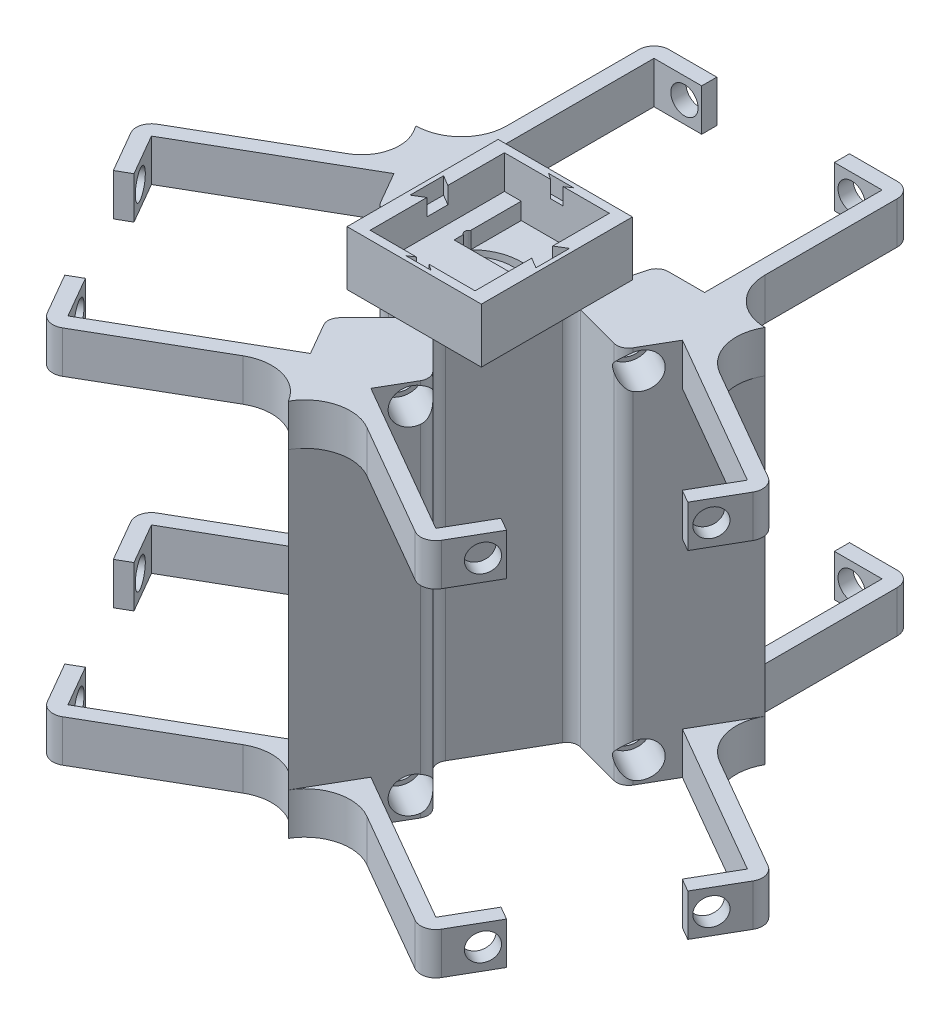
from build123d import *
from OCP.BRepAlgoAPI import BRepAlgoAPI_Cut
from OCP.TopTools import TopTools_ListOfShape

# Parameters (mm, degrees)
SALIENTE_EXTRUIR1_DEPTH = 95.5
CROQUIS4_R              = 3.25
CORTAR_EXTRUIR1_DEPTH   = 117.774868872
REDONDEO6_R             = 3
REDONDEO7_R             = 3
ESCALA2_SCALE           = 1.05
SALIENTE_EXTRUIR2_DEPTH = 100.275
REDONDEO8_R             = 12
REDONDEO9_R             = 12
REDONDEO12_R            = 12
REDONDEO13_R            = 12
REDONDEO14_R            = 12
REDONDEO16_R            = 10
REDONDEO17_R            = 3
ESCALA3_SCALE           = 0.9
CROQUIS25_W             = 45.9
CROQUIS25_H             = 70.2475
CORTAR_EXTRUIR8_DEPTH   = 157.896391831
MATRIZC1_START          = 12.62625
MATRIZC1_DEPTH          = 70.2475
CROQUIS27_R             = 4.25
CORTAR_EXTRUIR11_DEPTH  = 9
CROQUIS28_R             = 3.25
CORTAR_EXTRUIR12_DEPTH  = 1
MATRIZC2_START          = 15.015338577
MATRIZC2_OUTLINE_R      = 4.25
MATRIZC2_DEPTH          = 9
MATRIZC2_START_2        = 14.015338577
MATRIZC2_2_OUTLINE_R    = 3.25
MATRIZC2_2_DEPTH        = 1
MATRIZC2_START_3        = -23.99496433
MATRIZC2_3_OUTLINE_R    = 4.25
MATRIZC2_3_DEPTH        = 9
MATRIZC2_START_4        = -14.99496433
MATRIZC2_4_OUTLINE_R    = 3.25
MATRIZC2_4_DEPTH        = 1
CROQUIS29_R             = 3.25
CORTAR_EXTRUIR13_DEPTH  = 10
CROQUIS31_W             = 32
CROQUIS31_H             = 36
SALIENTE_EXTRUIR3_DEPTH = 13
CROQUIS33_W             = 25
CROQUIS33_H             = 32
CORTAR_EXTRUIR14_DEPTH  = 8
CORTAR_EXTRUIR15_DEPTH  = 146.30593318
CROQUIS39_W             = 17
CROQUIS39_H             = 16
CORTAR_EXTRUIR16_DEPTH  = 4
CORTAR_EXTRUIR17_DEPTH  = 4


with BuildPart() as part:
    # Croquis1 → Saliente-Extruir1 (new body)
    with BuildSketch(Plane(origin=(0, 0, 0), x_dir=(1, 0, 0), z_dir=(0, 1, 0))):
        Polygon((1.696358741, -16.064461222), (13.335, -27.703102481), (0, -50.8), (-13.335, -27.703102481), (-1.696358741, -16.064461222), (-14.760410887, 6.563140847), (-30.659090512, 2.303102481), (-43.994090512, 25.4), (-17.324090512, 25.4), (-13.064052146, 9.501320374), (13.064052146, 9.501320374), (17.324090512, 25.4), (43.994090512, 25.4), (30.659090512, 2.303102481), (14.760410887, 6.563140847), align=None)
    extrude(amount=SALIENTE_EXTRUIR1_DEPTH)

    # Croquis4 → Cortar-Extruir1 (cut, through all)
    with BuildSketch(Plane(origin=(0, 95.5, 0), x_dir=(1, 0, 0), z_dir=(0, 1, 0))):
        with Locations(Location((0, 0, 0), (0, 0, 270))):
            Circle(CROQUIS4_R)
    extrude(amount=-CORTAR_EXTRUIR1_DEPTH, mode=Mode.SUBTRACT)

    # Redondeo6
    redondeo6_edges = [part.edges().sort_by_distance(p)[0] for p in [
        (-1.696358741, 47.75, 16.064461222),
        (-14.760410887, 47.75, -6.563140847),
        (-13.064052146, 47.75, -9.501320374),
        (13.064052146, 47.75, -9.501320374),
        (1.696358741, 47.75, 16.064461222),
    ]]
    fillet(redondeo6_edges, radius=REDONDEO6_R)

    # Redondeo7
    redondeo7_edges = [part.edges().sort_by_distance(p)[0] for p in [
        (-13.335, 47.75, 27.703102481),
        (-30.659090512, 47.75, -2.303102481),
        (-17.324090512, 47.75, -25.4),
        (17.324090512, 47.75, -25.4),
        (30.659090512, 47.75, -2.303102481),
        (13.335, 47.75, 27.703102481),
    ]]
    fillet(redondeo7_edges, radius=REDONDEO7_R)


with BuildPart() as part_1:
    # Escala2: scaled about (-0.00814633, 47.75, 0.003262785)
    add(part.part.scale(ESCALA2_SCALE).moved(Location((0.000407317, -2.3875, -0.000163139))))

    # Croquis9 → Saliente-Extruir2 (add, through all)
    with BuildSketch(Plane(origin=(0, 97.8875, 0), x_dir=(1, 0, 0), z_dir=(0, 1, 0))):
        with BuildLine():
            Line((-34.193387721, 26.670163139), (-34.193387721, 73.670163139))
            ThreePointArc((-34.193387721, 73.670163139), (-33.021814846, 76.498590264), (-30.193387721, 77.670163139))
            Line((-30.193387721, 77.670163139), (-17.564301381, 77.670163139))
            Line((-17.564301381, 77.670163139), (-17.564301381, 73.670163139))
            Line((-17.564301381, 73.670163139), (-30.193387721, 73.670163139))
            Line((-30.193387721, 73.670163139), (-30.193387721, 26.670163139))
            Line((-30.193387721, 26.670163139), (-34.193387721, 26.670163139))
        make_face()
        with BuildLine():
            Line((-78.896409229, -10.686542049), (-38.193215251, 12.813457951))
            Line((-38.193215251, 12.813457951), (-40.193215251, 16.277559566))
            Line((-40.193215251, 16.277559566), (-80.896409229, -7.222440434))
            ThreePointArc((-80.896409229, -7.222440434), (-82.760112534, -9.651265869), (-82.360510844, -12.686542049))
            Line((-82.360510844, -12.686542049), (-76.045967674, -23.623651647))
            Line((-76.045967674, -23.623651647), (-72.581866058, -21.623651647))
            Line((-72.581866058, -21.623651647), (-78.896409229, -10.686542049))
        make_face()
        with BuildLine():
            Line((30.193387721, 73.670163139), (30.193387721, 26.670163139))
            Line((30.193387721, 26.670163139), (34.193387721, 26.670163139))
            Line((34.193387721, 26.670163139), (34.193387721, 73.670163139))
            ThreePointArc((34.193387721, 73.670163139), (33.021814846, 76.498590264), (30.193387721, 77.670163139))
            Line((30.193387721, 77.670163139), (17.564301381, 77.670163139))
            Line((17.564301381, 77.670163139), (17.564301381, 73.670163139))
            Line((17.564301381, 73.670163139), (30.193387721, 73.670163139))
        make_face()
        with BuildLine():
            Line((38.193732662, 12.813159223), (40.193732662, 16.277260839))
            Line((40.193732662, 16.277260839), (80.89692664, -7.222739161))
            ThreePointArc((80.89692664, -7.222739161), (82.760629945, -9.651564596), (82.361028255, -12.686840777))
            Line((82.361028255, -12.686840777), (76.046485085, -23.623950374))
            Line((76.046485085, -23.623950374), (72.58238347, -21.623950374))
            Line((72.58238347, -21.623950374), (78.89692664, -10.686840777))
            Line((78.89692664, -10.686840777), (38.193732662, 12.813159223))
        make_face()
        with BuildLine():
            Line((48.703538919, -62.983322363), (8.000344941, -39.483322363))
            Line((8.000344941, -39.483322363), (6.000344941, -42.947423978))
            Line((6.000344941, -42.947423978), (46.703538919, -66.447423978))
            ThreePointArc((46.703538919, -66.447423978), (49.738815099, -66.847025668), (52.167640534, -64.983322363))
            Line((52.167640534, -64.983322363), (58.482183704, -54.046212765))
            Line((58.482183704, -54.046212765), (55.018082089, -52.046212765))
            Line((55.018082089, -52.046212765), (48.703538919, -62.983322363))
        make_face()
        with BuildLine():
            Line((-7.99982753, -39.483023635), (-5.99982753, -42.94712525))
            Line((-5.99982753, -42.94712525), (-46.703021507, -66.44712525))
            ThreePointArc((-46.703021507, -66.44712525), (-49.738297688, -66.84672694), (-52.167123123, -64.983023635))
            Line((-52.167123123, -64.983023635), (-58.481666293, -54.045914037))
            Line((-58.481666293, -54.045914037), (-55.017564678, -52.045914037))
            Line((-55.017564678, -52.045914037), (-48.703021507, -62.983023635))
            Line((-48.703021507, -62.983023635), (-7.99982753, -39.483023635))
        make_face()
    extrude(amount=-SALIENTE_EXTRUIR2_DEPTH)

    # Redondeo8
    redondeo8_edges = [part_1.edges().sort_by_distance(p)[0] for p in [
        (-34.193387721, 47.75, -26.670163139),
    ]]
    fillet(redondeo8_edges, radius=REDONDEO8_R - 0.0001)  # a hair under: the kernel refuses the full size

    # Redondeo9
    redondeo9_edges = [part_1.edges().sort_by_distance(p)[0] for p in [
        (34.193387721, 47.75, -26.670163139),
    ]]
    fillet(redondeo9_edges, radius=REDONDEO9_R)

    # Redondeo12
    redondeo12_edges = [part_1.edges().sort_by_distance(p)[0] for p in [
        (6.000438504, 47.75, 42.947477997),
    ]]
    fillet(redondeo12_edges, radius=REDONDEO12_R)

    # Redondeo13
    redondeo13_edges = [part_1.edges().sort_by_distance(p)[0] for p in [
        (40.193826226, 47.75, -16.27720682),
    ]]
    fillet(redondeo13_edges, radius=REDONDEO13_R)

    # Redondeo14
    redondeo14_edges = [part_1.edges().sort_by_distance(p)[0] for p in [
        (-5.99982753, 47.75, 42.94712525),
    ]]
    fillet(redondeo14_edges, radius=REDONDEO14_R)

    # Redondeo16
    redondeo16_edges = [part_1.edges().sort_by_distance(p)[0] for p in [
        (-40.193215251, 47.75, -16.277559566),
    ]]
    fillet(redondeo16_edges, radius=REDONDEO16_R)

    # Redondeo17
    redondeo17_edges = [part_1.edges().sort_by_distance(p)[0] for p in [
        (15.498838747, 47.75, -6.891461029),
    ]]
    fillet(redondeo17_edges, radius=REDONDEO17_R)


with BuildPart() as part_2:
    # Escala3: scaled about (0.113970196, 47.75, 0.044501548)
    add(part_1.part.scale(ESCALA3_SCALE).moved(Location((0.01139702, 4.775, 0.004450155))))

    # Croquis25 → Cortar-Extruir8 (cut, symmetric)
    with BuildSketch(Plane(origin=(30.785445442, 0, 0), x_dir=(0, 0, -1), z_dir=(1, 0, 0))):
        with Locations((46.948697093, 47.75)):
            Rectangle(CROQUIS25_W, CROQUIS25_H)
    extrude(amount=CORTAR_EXTRUIR8_DEPTH, both=True, mode=Mode.SUBTRACT)


with BuildPart() as matrizc1_tool:
    # MatrizC1: read off the stored shape, not the designer's step
    # MatrizC1 outline → MatrizC1 (new body)
    with BuildSketch(Plane(origin=(0, 0, 0), x_dir=(1, 0, 0), z_dir=(0, 1, 0)).offset(MATRIZC1_START)):
        with BuildLine():
            ThreePointArc((-14.741522645, -44.056862457), (-6.546276958, -42.977937894), (0.011551716, -48.009936818))
            Line((0.011551716, -48.009936818), (-7.188448284, -35.539171003))
            Line((-7.188448284, -35.539171003), (-43.821322864, -56.689171003))
            Line((-43.821322864, -56.689171003), (-49.504411718, -46.845772366))
            Line((-49.504411718, -46.845772366), (-52.622103171, -48.645772366))
            Line((-52.622103171, -48.645772366), (-46.939014318, -58.489171003))
            ThreePointArc((-46.939014318, -58.489171003), (-44.753071427, -60.166503978), (-42.021322864, -59.806862457))
            Line((-42.021322864, -59.806862457), (-14.741522645, -44.056862457))
        make_face()
        with BuildLine():
            Line((7.211791146, -35.539488475), (0.011791146, -48.01025429))
            ThreePointArc((0.011791146, -48.01025429), (6.56961982, -42.978255366), (14.764865507, -44.057179929))
            Line((14.764865507, -44.057179929), (42.044581519, -59.807131312))
            ThreePointArc((42.044581519, -59.807131312), (44.776330082, -60.166772833), (46.962272973, -58.489439858))
            Line((46.962272973, -58.489439858), (52.645361826, -48.646041221))
            Line((52.645361826, -48.646041221), (49.527670373, -46.846041221))
            Line((49.527670373, -46.846041221), (43.844581519, -56.689439858))
            Line((43.844581519, -56.689439858), (7.211791146, -35.539488475))
        make_face()
        with BuildLine():
            Line((-70.995371814, -9.622337576), (-34.362497233, 11.527662424))
            Line((-34.362497233, 11.527662424), (-40.662497233, 22.439582512))
            ThreePointArc((-40.662497233, 22.439582512), (-39.763393431, 15.610211106), (-43.956725868, 10.145353878))
            Line((-43.956725868, 10.145353878), (-72.795371814, -6.504646122))
            ThreePointArc((-72.795371814, -6.504646122), (-74.472704788, -8.690589014), (-74.113063267, -11.422337576))
            Line((-74.113063267, -11.422337576), (-68.429974414, -21.265736214))
            Line((-68.429974414, -21.265736214), (-65.31228296, -19.465736214))
            Line((-65.31228296, -19.465736214), (-70.995371814, -9.622337576))
        make_face()
        with BuildLine():
            ThreePointArc((45.538914456, 9.245036406), (40.506915532, 15.80286508), (41.585840095, 23.998110767))
            Line((41.585840095, 23.998110767), (34.385840095, 11.527344952))
            Line((34.385840095, 11.527344952), (71.018630468, -9.622606431))
            Line((71.018630468, -9.622606431), (65.335541615, -19.466005069))
            Line((65.335541615, -19.466005069), (68.453233069, -21.266005069))
            Line((68.453233069, -21.266005069), (74.136321922, -11.422606431))
            ThreePointArc((74.136321922, -11.422606431), (74.495963443, -8.690857868), (72.818630468, -6.504914977))
            Line((72.818630468, -6.504914977), (45.538914456, 9.245036406))
        make_face()
    extrude(amount=MATRIZC1_DEPTH)


with BuildPart() as part_3:
    add(part_2.part)

    # MatrizC1: cut by matrizc1_tool, with a tolerance
    matrizc1_stock = TopTools_ListOfShape()
    matrizc1_stock.Append(part_3.part.wrapped)
    matrizc1_tools = TopTools_ListOfShape()
    matrizc1_tools.Append(matrizc1_tool.part.wrapped)
    matrizc1_cut = BRepAlgoAPI_Cut()
    matrizc1_cut.SetArguments(matrizc1_stock)
    matrizc1_cut.SetTools(matrizc1_tools)
    matrizc1_cut.SetFuzzyValue(0.00001)
    matrizc1_cut.Build()
    add(Compound.cast(matrizc1_cut.Shape()).solids(), mode=Mode.REPLACE)

    # Croquis27 → Cortar-Extruir11 (cut)
    with BuildSketch(Plane(origin=(0, 0, -23.998697093), x_dir=(-1, 0, 0), z_dir=(0, 0, -1))):
        with Locations((19.912652457, 87.87375)):
            Circle(CROQUIS27_R)
        with Locations((19.912652457, 7.62625)):
            Circle(CROQUIS27_R)
        with Locations(Location((-19.935445442, 7.62625, 0), (0, 0, 345.544059241))):
            Circle(CROQUIS27_R)
        with Locations(Location((-19.935445442, 87.87375, 0), (0, 0, 345.544059241))):
            Circle(CROQUIS27_R)
    extrude(amount=-CORTAR_EXTRUIR11_DEPTH, mode=Mode.SUBTRACT)

    # Croquis28 → Cortar-Extruir12 (cut)
    with BuildSketch(Plane(origin=(0, 0, -14.998697093), x_dir=(-1, 0, 0), z_dir=(0, 0, -1))):
        with Locations((19.912652457, 87.87375)):
            Circle(CROQUIS28_R)
        with Locations((19.912652457, 7.62625)):
            Circle(CROQUIS28_R)
        with Locations((-19.935445442, 7.62625)):
            Circle(CROQUIS28_R)
        with Locations((-19.935445442, 87.87375)):
            Circle(CROQUIS28_R)
    extrude(amount=-CORTAR_EXTRUIR12_DEPTH, mode=Mode.SUBTRACT)


with BuildPart() as matrizc2_tool:
    # MatrizC2: read off the stored shape, not the designer's step
    # MatrizC2 outline → MatrizC2 (new body)
    with BuildSketch(Plane(origin=(0, 0, 0), x_dir=(0.49999999999999833, 0, -0.8660254037844396), z_dir=(0.8660254037844396, 0, 0.49999999999999833)).offset(MATRIZC2_START)):
        with Locations((-19.921527252, 87.87375)):
            Circle(MATRIZC2_OUTLINE_R)
        with Locations((-19.921527252, 7.62625)):
            Circle(MATRIZC2_OUTLINE_R)
        with Locations((19.926570646, 7.62625)):
            Circle(MATRIZC2_OUTLINE_R)
        with Locations((19.926570646, 87.87375)):
            Circle(MATRIZC2_OUTLINE_R)
    extrude(amount=MATRIZC2_DEPTH)


with BuildPart() as part_4:
    add(part_3.part)

    # MatrizC2: cut by matrizc2_tool, with a tolerance
    matrizc2_stock = TopTools_ListOfShape()
    matrizc2_stock.Append(part_4.part.wrapped)
    matrizc2_tools = TopTools_ListOfShape()
    matrizc2_tools.Append(matrizc2_tool.part.wrapped)
    matrizc2_cut = BRepAlgoAPI_Cut()
    matrizc2_cut.SetArguments(matrizc2_stock)
    matrizc2_cut.SetTools(matrizc2_tools)
    matrizc2_cut.SetFuzzyValue(0.00001)
    matrizc2_cut.Build()
    add(Compound.cast(matrizc2_cut.Shape()).solids(), mode=Mode.REPLACE)


with BuildPart() as matrizc2_2_tool:
    # MatrizC2 2 outline → MatrizC2 2 (new body)
    with BuildSketch(Plane(origin=(0, 0, 0), x_dir=(0.49999999999999833, 0, -0.8660254037844396), z_dir=(0.8660254037844396, 0, 0.49999999999999833)).offset(MATRIZC2_START_2)):
        with Locations((-19.921527252, 87.87375)):
            Circle(MATRIZC2_2_OUTLINE_R)
        with Locations((-19.921527252, 7.62625)):
            Circle(MATRIZC2_2_OUTLINE_R)
        with Locations((19.926570646, 7.62625)):
            Circle(MATRIZC2_2_OUTLINE_R)
        with Locations((19.926570646, 87.87375)):
            Circle(MATRIZC2_2_OUTLINE_R)
    extrude(amount=MATRIZC2_2_DEPTH)


with BuildPart() as part_5:
    add(part_4.part)

    # MatrizC2 2: cut by matrizc2_2_tool, with a tolerance
    matrizc2_2_stock = TopTools_ListOfShape()
    matrizc2_2_stock.Append(part_5.part.wrapped)
    matrizc2_2_tools = TopTools_ListOfShape()
    matrizc2_2_tools.Append(matrizc2_2_tool.part.wrapped)
    matrizc2_2_cut = BRepAlgoAPI_Cut()
    matrizc2_2_cut.SetArguments(matrizc2_2_stock)
    matrizc2_2_cut.SetTools(matrizc2_2_tools)
    matrizc2_2_cut.SetFuzzyValue(0.00001)
    matrizc2_2_cut.Build()
    add(Compound.cast(matrizc2_2_cut.Shape()).solids(), mode=Mode.REPLACE)


with BuildPart() as matrizc2_3_tool:
    # MatrizC2 3 outline → MatrizC2 3 (new body)
    with BuildSketch(Plane(origin=(0, 0, 0), x_dir=(0.4999999999999969, 0, 0.8660254037844405), z_dir=(0.8660254037844404, 0, -0.49999999999999717)).offset(MATRIZC2_START_3)):
        with Locations((19.934023499, -87.87375)):
            Circle(MATRIZC2_3_OUTLINE_R)
        with Locations((19.934023499, -7.62625)):
            Circle(MATRIZC2_3_OUTLINE_R)
        with Locations((-19.914074399, -87.87375)):
            Circle(MATRIZC2_3_OUTLINE_R)
        with Locations((-19.914074399, -7.62625)):
            Circle(MATRIZC2_3_OUTLINE_R)
    extrude(amount=MATRIZC2_3_DEPTH)


with BuildPart() as part_6:
    add(part_5.part)

    # MatrizC2 3: cut by matrizc2_3_tool, with a tolerance
    matrizc2_3_stock = TopTools_ListOfShape()
    matrizc2_3_stock.Append(part_6.part.wrapped)
    matrizc2_3_tools = TopTools_ListOfShape()
    matrizc2_3_tools.Append(matrizc2_3_tool.part.wrapped)
    matrizc2_3_cut = BRepAlgoAPI_Cut()
    matrizc2_3_cut.SetArguments(matrizc2_3_stock)
    matrizc2_3_cut.SetTools(matrizc2_3_tools)
    matrizc2_3_cut.SetFuzzyValue(0.00001)
    matrizc2_3_cut.Build()
    add(Compound.cast(matrizc2_3_cut.Shape()).solids(), mode=Mode.REPLACE)


with BuildPart() as matrizc2_4_tool:
    # MatrizC2 4 outline → MatrizC2 4 (new body)
    with BuildSketch(Plane(origin=(0, 0, 0), x_dir=(0.4999999999999969, 0, 0.8660254037844405), z_dir=(0.8660254037844404, 0, -0.49999999999999717)).offset(MATRIZC2_START_4)):
        with Locations((19.934023499, -87.87375)):
            Circle(MATRIZC2_4_OUTLINE_R)
        with Locations((19.934023499, -7.62625)):
            Circle(MATRIZC2_4_OUTLINE_R)
        with Locations((-19.914074399, -87.87375)):
            Circle(MATRIZC2_4_OUTLINE_R)
        with Locations((-19.914074399, -7.62625)):
            Circle(MATRIZC2_4_OUTLINE_R)
    extrude(amount=MATRIZC2_4_DEPTH)


with BuildPart() as part_7:
    add(part_6.part)

    # MatrizC2 4: cut by matrizc2_4_tool, with a tolerance
    matrizc2_4_stock = TopTools_ListOfShape()
    matrizc2_4_stock.Append(part_7.part.wrapped)
    matrizc2_4_tools = TopTools_ListOfShape()
    matrizc2_4_tools.Append(matrizc2_4_tool.part.wrapped)
    matrizc2_4_cut = BRepAlgoAPI_Cut()
    matrizc2_4_cut.SetArguments(matrizc2_4_stock)
    matrizc2_4_cut.SetTools(matrizc2_4_tools)
    matrizc2_4_cut.SetFuzzyValue(0.00001)
    matrizc2_4_cut.Build()
    add(Compound.cast(matrizc2_4_cut.Shape()).solids(), mode=Mode.REPLACE)

    # Croquis29 → Cortar-Extruir13 (cut)
    with BuildSketch(Plane(origin=(-60.530814706, 0, 34.947482165), x_dir=(0.49999999999999983, 0, 0.8660254037844388), z_dir=(-0.8660254037844387, 0, 0.4999999999999998))):
        with Locations((-19.914074399, 7.62625)):
            Circle(CROQUIS29_R)
        with Locations((19.934023499, 7.62625)):
            Circle(CROQUIS29_R)
        with Locations((19.934023499, 87.87375)):
            Circle(CROQUIS29_R)
        with Locations((-19.914074399, 87.87375)):
            Circle(CROQUIS29_R)
    extrude(amount=-CORTAR_EXTRUIR13_DEPTH, mode=Mode.SUBTRACT)


with BuildPart() as matrizc3_tool:
    # MatrizC3: read off the stored shape, not the designer's step
    # MatrizC3: loft between two sections, ruled curve by curve
    matrizc3_from = [
        Edge.make_three_point_arc((-23.162652457, 7.62625, -66.298697093), (-19.912652457, 10.87625, -66.298697093), (-16.662652457, 7.62625, -66.298697093)),
        Edge.make_three_point_arc((-16.662652457, 7.62625, -66.298697093), (-19.912652457, 4.37625, -66.298697093), (-23.162652457, 7.62625, -66.298697093)),
    ]
    matrizc3_to = [
        Edge.make_three_point_arc((-23.162652457, 7.62625, -69.898697093), (-19.912652457, 10.87625, -69.898697093), (-16.662652457, 7.62625, -69.898697093)),
        Edge.make_three_point_arc((-16.662652457, 7.62625, -69.898697093), (-19.912652457, 4.37625, -69.898697093), (-23.162652457, 7.62625, -69.898697093)),
    ]
    matrizc3 = Solid(Shell([*[Face.make_surface_from_curves(matrizc3_from[k], matrizc3_to[k]) for k in range(2)], Face(Wire(matrizc3_from)), Face(Wire(matrizc3_to))]))
    add(matrizc3)


with BuildPart() as part_8:
    add(part_7.part)

    # MatrizC3: cut by matrizc3_tool, with a tolerance
    matrizc3_stock = TopTools_ListOfShape()
    matrizc3_stock.Append(part_8.part.wrapped)
    matrizc3_tools = TopTools_ListOfShape()
    matrizc3_tools.Append(matrizc3_tool.part.wrapped)
    matrizc3_cut = BRepAlgoAPI_Cut()
    matrizc3_cut.SetArguments(matrizc3_stock)
    matrizc3_cut.SetTools(matrizc3_tools)
    matrizc3_cut.SetFuzzyValue(0.00001)
    matrizc3_cut.Build()
    add(Compound.cast(matrizc3_cut.Shape()).solids(), mode=Mode.REPLACE)


with BuildPart() as matrizc3_2_tool:
    # MatrizC3 2: loft between two sections, ruled curve by curve
    matrizc3_2_from = [
        Edge.make_three_point_arc((-23.162652457, 87.87375, -66.298697093), (-19.912652457, 91.12375, -66.298697093), (-16.662652457, 87.87375, -66.298697093)),
        Edge.make_three_point_arc((-16.662652457, 87.87375, -66.298697093), (-19.912652457, 84.62375, -66.298697093), (-23.162652457, 87.87375, -66.298697093)),
    ]
    matrizc3_2_to = [
        Edge.make_three_point_arc((-23.162652457, 87.87375, -69.898697093), (-19.912652457, 91.12375, -69.898697093), (-16.662652457, 87.87375, -69.898697093)),
        Edge.make_three_point_arc((-16.662652457, 87.87375, -69.898697093), (-19.912652457, 84.62375, -69.898697093), (-23.162652457, 87.87375, -69.898697093)),
    ]
    matrizc3_2 = Solid(Shell([*[Face.make_surface_from_curves(matrizc3_2_from[k], matrizc3_2_to[k]) for k in range(2)], Face(Wire(matrizc3_2_from)), Face(Wire(matrizc3_2_to))]))
    add(matrizc3_2)


with BuildPart() as part_9:
    add(part_8.part)

    # MatrizC3 2: cut by matrizc3_2_tool, with a tolerance
    matrizc3_2_stock = TopTools_ListOfShape()
    matrizc3_2_stock.Append(part_9.part.wrapped)
    matrizc3_2_tools = TopTools_ListOfShape()
    matrizc3_2_tools.Append(matrizc3_2_tool.part.wrapped)
    matrizc3_2_cut = BRepAlgoAPI_Cut()
    matrizc3_2_cut.SetArguments(matrizc3_2_stock)
    matrizc3_2_cut.SetTools(matrizc3_2_tools)
    matrizc3_2_cut.SetFuzzyValue(0.00001)
    matrizc3_2_cut.Build()
    add(Compound.cast(matrizc3_2_cut.Shape()).solids(), mode=Mode.REPLACE)


with BuildPart() as matrizc3_3_tool:
    # MatrizC3 3: loft between two sections, ruled curve by curve
    matrizc3_3_from = [
        Edge.make_three_point_arc((16.685445442, 87.87375, -66.298697093), (19.935445442, 91.12375, -66.298697093), (23.185445442, 87.87375, -66.298697093)),
        Edge.make_three_point_arc((23.185445442, 87.87375, -66.298697093), (19.935445442, 84.62375, -66.298697093), (16.685445442, 87.87375, -66.298697093)),
    ]
    matrizc3_3_to = [
        Edge.make_three_point_arc((16.685445442, 87.87375, -69.898697093), (19.935445442, 91.12375, -69.898697093), (23.185445442, 87.87375, -69.898697093)),
        Edge.make_three_point_arc((23.185445442, 87.87375, -69.898697093), (19.935445442, 84.62375, -69.898697093), (16.685445442, 87.87375, -69.898697093)),
    ]
    matrizc3_3 = Solid(Shell([*[Face.make_surface_from_curves(matrizc3_3_from[k], matrizc3_3_to[k]) for k in range(2)], Face(Wire(matrizc3_3_from)), Face(Wire(matrizc3_3_to))]))
    add(matrizc3_3)


with BuildPart() as part_10:
    add(part_9.part)

    # MatrizC3 3: cut by matrizc3_3_tool, with a tolerance
    matrizc3_3_stock = TopTools_ListOfShape()
    matrizc3_3_stock.Append(part_10.part.wrapped)
    matrizc3_3_tools = TopTools_ListOfShape()
    matrizc3_3_tools.Append(matrizc3_3_tool.part.wrapped)
    matrizc3_3_cut = BRepAlgoAPI_Cut()
    matrizc3_3_cut.SetArguments(matrizc3_3_stock)
    matrizc3_3_cut.SetTools(matrizc3_3_tools)
    matrizc3_3_cut.SetFuzzyValue(0.00001)
    matrizc3_3_cut.Build()
    add(Compound.cast(matrizc3_3_cut.Shape()).solids(), mode=Mode.REPLACE)


with BuildPart() as matrizc3_4_tool:
    # MatrizC3 4: loft between two sections, ruled curve by curve
    matrizc3_4_from = [
        Edge.make_three_point_arc((16.685445442, 7.62625, -66.298697093), (19.935445442, 10.87625, -66.298697093), (23.185445442, 7.62625, -66.298697093)),
        Edge.make_three_point_arc((23.185445442, 7.62625, -66.298697093), (19.935445442, 4.37625, -66.298697093), (16.685445442, 7.62625, -66.298697093)),
    ]
    matrizc3_4_to = [
        Edge.make_three_point_arc((16.685445442, 7.62625, -69.898697093), (19.935445442, 10.87625, -69.898697093), (23.185445442, 7.62625, -69.898697093)),
        Edge.make_three_point_arc((23.185445442, 7.62625, -69.898697093), (19.935445442, 4.37625, -69.898697093), (16.685445442, 7.62625, -69.898697093)),
    ]
    matrizc3_4 = Solid(Shell([*[Face.make_surface_from_curves(matrizc3_4_from[k], matrizc3_4_to[k]) for k in range(2)], Face(Wire(matrizc3_4_from)), Face(Wire(matrizc3_4_to))]))
    add(matrizc3_4)


with BuildPart() as part_11:
    add(part_10.part)

    # MatrizC3 4: cut by matrizc3_4_tool, with a tolerance
    matrizc3_4_stock = TopTools_ListOfShape()
    matrizc3_4_stock.Append(part_11.part.wrapped)
    matrizc3_4_tools = TopTools_ListOfShape()
    matrizc3_4_tools.Append(matrizc3_4_tool.part.wrapped)
    matrizc3_4_cut = BRepAlgoAPI_Cut()
    matrizc3_4_cut.SetArguments(matrizc3_4_stock)
    matrizc3_4_cut.SetTools(matrizc3_4_tools)
    matrizc3_4_cut.SetFuzzyValue(0.00001)
    matrizc3_4_cut.Build()
    add(Compound.cast(matrizc3_4_cut.Shape()).solids(), mode=Mode.REPLACE)


with BuildPart() as matrizc3_5_tool:
    # MatrizC3 5: loft between two sections, ruled curve by curve
    matrizc3_5_from = [
        Edge.make_three_point_arc((69.018968984, 87.87375, 13.086121719), (67.393968984, 91.12375, 15.900704282), (65.768968984, 87.87375, 18.715286844)),
        Edge.make_three_point_arc((65.768968984, 87.87375, 18.715286844), (67.393968984, 84.62375, 15.900704282), (69.018968984, 87.87375, 13.086121719)),
    ]
    matrizc3_5_to = [
        Edge.make_three_point_arc((72.136660438, 87.87375, 14.886121719), (70.511660438, 91.12375, 17.700704282), (68.886660438, 87.87375, 20.515286844)),
        Edge.make_three_point_arc((68.886660438, 87.87375, 20.515286844), (70.511660438, 84.62375, 17.700704282), (72.136660438, 87.87375, 14.886121719)),
    ]
    matrizc3_5 = Solid(Shell([*[Face.make_surface_from_curves(matrizc3_5_from[k], matrizc3_5_to[k]) for k in range(2)], Face(Wire(matrizc3_5_from)), Face(Wire(matrizc3_5_to))]))
    add(matrizc3_5)


with BuildPart() as part_12:
    add(part_11.part)

    # MatrizC3 5: cut by matrizc3_5_tool, with a tolerance
    matrizc3_5_stock = TopTools_ListOfShape()
    matrizc3_5_stock.Append(part_12.part.wrapped)
    matrizc3_5_tools = TopTools_ListOfShape()
    matrizc3_5_tools.Append(matrizc3_5_tool.part.wrapped)
    matrizc3_5_cut = BRepAlgoAPI_Cut()
    matrizc3_5_cut.SetArguments(matrizc3_5_stock)
    matrizc3_5_cut.SetTools(matrizc3_5_tools)
    matrizc3_5_cut.SetFuzzyValue(0.00001)
    matrizc3_5_cut.Build()
    add(Compound.cast(matrizc3_5_cut.Shape()).solids(), mode=Mode.REPLACE)


with BuildPart() as matrizc3_6_tool:
    # MatrizC3 6: loft between two sections, ruled curve by curve
    matrizc3_6_from = [
        Edge.make_three_point_arc((69.018968984, 7.62625, 13.086121719), (67.393968984, 10.87625, 15.900704282), (65.768968984, 7.62625, 18.715286844)),
        Edge.make_three_point_arc((65.768968984, 7.62625, 18.715286844), (67.393968984, 4.37625, 15.900704282), (69.018968984, 7.62625, 13.086121719)),
    ]
    matrizc3_6_to = [
        Edge.make_three_point_arc((72.136660438, 7.62625, 14.886121719), (70.511660438, 10.87625, 17.700704282), (68.886660438, 7.62625, 20.515286844)),
        Edge.make_three_point_arc((68.886660438, 7.62625, 20.515286844), (70.511660438, 4.37625, 17.700704282), (72.136660438, 7.62625, 14.886121719)),
    ]
    matrizc3_6 = Solid(Shell([*[Face.make_surface_from_curves(matrizc3_6_from[k], matrizc3_6_to[k]) for k in range(2)], Face(Wire(matrizc3_6_from)), Face(Wire(matrizc3_6_to))]))
    add(matrizc3_6)


with BuildPart() as part_13:
    add(part_12.part)

    # MatrizC3 6: cut by matrizc3_6_tool, with a tolerance
    matrizc3_6_stock = TopTools_ListOfShape()
    matrizc3_6_stock.Append(part_13.part.wrapped)
    matrizc3_6_tools = TopTools_ListOfShape()
    matrizc3_6_tools.Append(matrizc3_6_tool.part.wrapped)
    matrizc3_6_cut = BRepAlgoAPI_Cut()
    matrizc3_6_cut.SetArguments(matrizc3_6_stock)
    matrizc3_6_cut.SetTools(matrizc3_6_tools)
    matrizc3_6_cut.SetFuzzyValue(0.00001)
    matrizc3_6_cut.Build()
    add(Compound.cast(matrizc3_6_cut.Shape()).solids(), mode=Mode.REPLACE)


with BuildPart() as matrizc3_7_tool:
    # MatrizC3 7: loft between two sections, ruled curve by curve
    matrizc3_7_from = [
        Edge.make_three_point_arc((49.094920035, 7.62625, 47.595586792), (47.469920035, 10.87625, 50.410169354), (45.844920035, 7.62625, 53.224751917)),
        Edge.make_three_point_arc((45.844920035, 7.62625, 53.224751917), (47.469920035, 4.37625, 50.410169354), (49.094920035, 7.62625, 47.595586792)),
    ]
    matrizc3_7_to = [
        Edge.make_three_point_arc((52.212611489, 7.62625, 49.395586792), (50.587611489, 10.87625, 52.210169354), (48.962611489, 7.62625, 55.024751917)),
        Edge.make_three_point_arc((48.962611489, 7.62625, 55.024751917), (50.587611489, 4.37625, 52.210169354), (52.212611489, 7.62625, 49.395586792)),
    ]
    matrizc3_7 = Solid(Shell([*[Face.make_surface_from_curves(matrizc3_7_from[k], matrizc3_7_to[k]) for k in range(2)], Face(Wire(matrizc3_7_from)), Face(Wire(matrizc3_7_to))]))
    add(matrizc3_7)


with BuildPart() as part_14:
    add(part_13.part)

    # MatrizC3 7: cut by matrizc3_7_tool, with a tolerance
    matrizc3_7_stock = TopTools_ListOfShape()
    matrizc3_7_stock.Append(part_14.part.wrapped)
    matrizc3_7_tools = TopTools_ListOfShape()
    matrizc3_7_tools.Append(matrizc3_7_tool.part.wrapped)
    matrizc3_7_cut = BRepAlgoAPI_Cut()
    matrizc3_7_cut.SetArguments(matrizc3_7_stock)
    matrizc3_7_cut.SetTools(matrizc3_7_tools)
    matrizc3_7_cut.SetFuzzyValue(0.00001)
    matrizc3_7_cut.Build()
    add(Compound.cast(matrizc3_7_cut.Shape()).solids(), mode=Mode.REPLACE)


with BuildPart() as matrizc3_8_tool:
    # MatrizC3 8: loft between two sections, ruled curve by curve
    matrizc3_8_from = [
        Edge.make_three_point_arc((49.094920035, 87.87375, 47.595586792), (47.469920035, 91.12375, 50.410169354), (45.844920035, 87.87375, 53.224751917)),
        Edge.make_three_point_arc((45.844920035, 87.87375, 53.224751917), (47.469920035, 84.62375, 50.410169354), (49.094920035, 87.87375, 47.595586792)),
    ]
    matrizc3_8_to = [
        Edge.make_three_point_arc((52.212611489, 87.87375, 49.395586792), (50.587611489, 91.12375, 52.210169354), (48.962611489, 87.87375, 55.024751917)),
        Edge.make_three_point_arc((48.962611489, 87.87375, 55.024751917), (50.587611489, 84.62375, 52.210169354), (52.212611489, 87.87375, 49.395586792)),
    ]
    matrizc3_8 = Solid(Shell([*[Face.make_surface_from_curves(matrizc3_8_from[k], matrizc3_8_to[k]) for k in range(2)], Face(Wire(matrizc3_8_from)), Face(Wire(matrizc3_8_to))]))
    add(matrizc3_8)


with BuildPart() as part_15:
    add(part_14.part)

    # MatrizC3 8: cut by matrizc3_8_tool, with a tolerance
    matrizc3_8_stock = TopTools_ListOfShape()
    matrizc3_8_stock.Append(part_15.part.wrapped)
    matrizc3_8_tools = TopTools_ListOfShape()
    matrizc3_8_tools.Append(matrizc3_8_tool.part.wrapped)
    matrizc3_8_cut = BRepAlgoAPI_Cut()
    matrizc3_8_cut.SetArguments(matrizc3_8_stock)
    matrizc3_8_cut.SetTools(matrizc3_8_tools)
    matrizc3_8_cut.SetFuzzyValue(0.00001)
    matrizc3_8_cut.Build()
    add(Compound.cast(matrizc3_8_cut.Shape()).solids(), mode=Mode.REPLACE)

    # Croquis31 → Saliente-Extruir3 (add)
    with BuildSketch(Plane(origin=(0, 92.87375, 0), x_dir=(1, 0, 0), z_dir=(0, 1, 0))):
        Rectangle(CROQUIS31_W, CROQUIS31_H)
    extrude(amount=SALIENTE_EXTRUIR3_DEPTH)

    # Croquis33 → Cortar-Extruir14 (cut)
    with BuildSketch(Plane(origin=(0, 105.87375, 0), x_dir=(1, 0, 0), z_dir=(0, 1, 0))):
        Rectangle(CROQUIS33_W, CROQUIS33_H)
    extrude(amount=-CORTAR_EXTRUIR14_DEPTH, mode=Mode.SUBTRACT)

    # Croquis38 → Cortar-Extruir15 (cut, through all)
    with BuildSketch(Plane.XZ.offset(-2.62625)):
        with BuildLine():
            ThreePointArc((-8.727272727, -3.73618302), (0, -7.5), (8.727272727, -3.73618302))
            ThreePointArc((8.727272727, -3.73618302), (8.686348585, -2.322561708), (7.272727273, -2.36348585))
            ThreePointArc((7.272727273, -2.36348585), (0, -5.5), (-7.272727273, -2.36348585))
            ThreePointArc((-7.272727273, -2.36348585), (-8.686348585, -2.322561708), (-8.727272727, -3.73618302))
        make_face()
    extrude(amount=-CORTAR_EXTRUIR15_DEPTH, mode=Mode.SUBTRACT)

    # Croquis39 → Cortar-Extruir16 (cut)
    with BuildSketch(Plane(origin=(0, 97.87375, 0), x_dir=(1, 0, 0), z_dir=(0, 1, 0))):
        with Locations((0, 8)):
            Rectangle(CROQUIS39_W, CROQUIS39_H)
    extrude(amount=-CORTAR_EXTRUIR16_DEPTH, mode=Mode.SUBTRACT)

    # Croquis41 → Cortar-Extruir17 (cut)
    with BuildSketch(Plane(origin=(0, 105.87375, 0), x_dir=(1, 0, 0), z_dir=(0, 1, 0))):
        Polygon((-1.5, -16), (-3, -17), (3, -17), (1.5, -16), align=None)
        Polygon((3, 17), (1.5, 16), (-1.5, 16), (-3, 17), align=None)
        Polygon((12.5, 2.5), (12.5, -2.5), (15, -4), (15, 4), align=None)
        Polygon((-12.5, -2.5), (-12.5, 2.5), (-15, 4), (-15, -4), align=None)
    extrude(amount=-CORTAR_EXTRUIR17_DEPTH, mode=Mode.SUBTRACT)


solid = part_15.part
